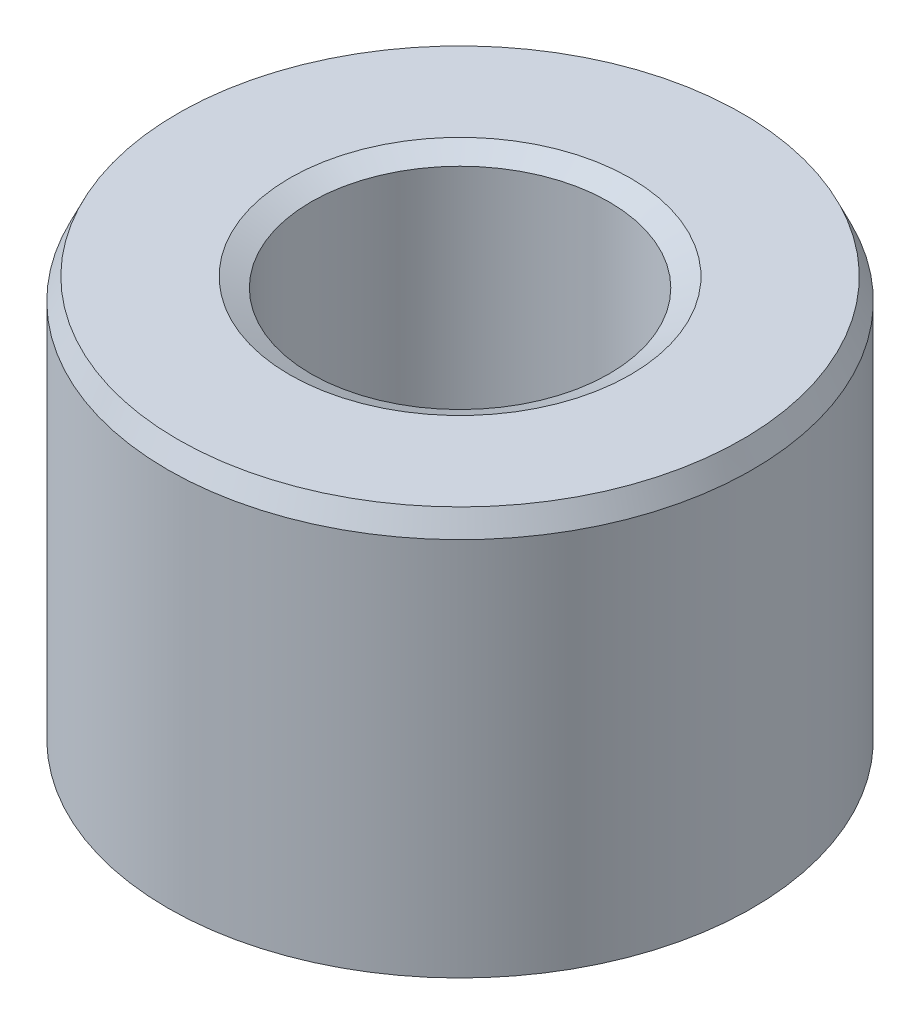
from build123d import *
from OCP.BRepFilletAPI import BRepFilletAPI_MakeChamfer

# Parameters (mm, degrees)
SKETCH1_R           = 45
BOSS_EXTRUDE1_DEPTH = 63.265217348
SKETCH2_R           = 22.947593193
CUT_EXTRUDE1_DEPTH  = 90.735654709
CHAMFER1_SIZE       = 3.286818912
CHAMFER1_SIZE2      = 1.527630792


with BuildPart() as part:
    # Sketch1 → Boss-Extrude1 (new body)
    with BuildSketch(Plane(origin=(0, 0, 0), x_dir=(1, 0, 0), z_dir=(0, 1, 0))):
        Circle(SKETCH1_R)
    extrude(amount=BOSS_EXTRUDE1_DEPTH)

    # Sketch2 → Cut-Extrude1 (cut, through all)
    with BuildSketch(Plane(origin=(0, 0, 0), x_dir=(1, 0, 0), z_dir=(0, 1, 0))):
        Circle(SKETCH2_R)
    extrude(amount=CUT_EXTRUDE1_DEPTH, mode=Mode.SUBTRACT)

    # Chamfer1: one chamfer whose edges measure the first distance from different faces: ONE call of the kernel's chamfer builder (chamfer() names one face for all edges)
    chamfer1_edges_1 = [part.edges().sort_by_distance(p)[0] for p in [
        (-22.947593193, 63.265217348, 0),
    ]]
    chamfer1_side_1 = [part.faces().sort_by_distance(p)[0] for p in [
        (-43.727207794, 63.265217348, 0),
    ]]
    chamfer1_edges_2 = [part.edges().sort_by_distance(p)[0] for p in [
        (-22.947593193, 0, 0),
    ]]
    chamfer1_side_2 = [part.faces().sort_by_distance(p)[0] for p in [
        (-22.947593193, 31.632608674, 0),
    ]]
    chamfer1_edges_3 = [part.edges().sort_by_distance(p)[0] for p in [
        (-45, 0, 0),
    ]]
    chamfer1_side_3 = [part.faces().sort_by_distance(p)[0] for p in [
        (-43.727207794, 0, 0),
    ]]
    chamfer1_edges_4 = [part.edges().sort_by_distance(p)[0] for p in [
        (-45, 63.265217348, 0),
    ]]
    chamfer1_side_4 = [part.faces().sort_by_distance(p)[0] for p in [
        (-45, 31.632608674, 0),
    ]]
    chamfer1 = BRepFilletAPI_MakeChamfer(part.part.solid().wrapped)
    for e in chamfer1_edges_1:
        chamfer1.Add(CHAMFER1_SIZE, CHAMFER1_SIZE2, e.wrapped, chamfer1_side_1[0].wrapped)  # the first distance lies on this face
    for e in chamfer1_edges_2:
        chamfer1.Add(CHAMFER1_SIZE, CHAMFER1_SIZE2, e.wrapped, chamfer1_side_2[0].wrapped)  # the first distance lies on this face
    for e in chamfer1_edges_3:
        chamfer1.Add(CHAMFER1_SIZE, CHAMFER1_SIZE2, e.wrapped, chamfer1_side_3[0].wrapped)  # the first distance lies on this face
    for e in chamfer1_edges_4:
        chamfer1.Add(CHAMFER1_SIZE, CHAMFER1_SIZE2, e.wrapped, chamfer1_side_4[0].wrapped)  # the first distance lies on this face
    add(Compound.cast(chamfer1.Shape()), mode=Mode.REPLACE)


solid = part.part
